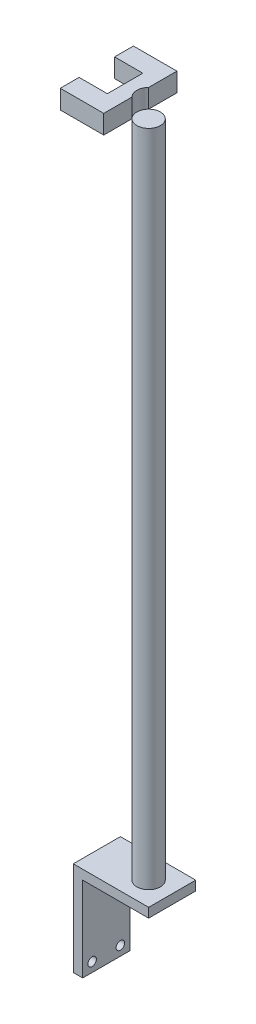
from build123d import *

# Parameters (mm, degrees)
SZKIC1_W                    = 50
SZKIC1_H                    = 100
SZKIC1_R                    = 4.5
DODANIE_WYCI_GNI_CIE1_DEPTH = 10
SZKIC2_W                    = 80
SZKIC2_H                    = 10
DODANIE_WYCI_GNI_CIE2_DEPTH = 50
SZKIC3_R                    = 12.5
DODANIE_WYCI_GNI_CIE3_DEPTH = 700
DODANIE_WYCI_GNI_CIE4_DEPTH = 20


with BuildPart() as part:
    # Szkic1 → Dodanie-wyciągnięcie1 (new body)
    with BuildSketch(Plane(origin=(0, 0, 0), x_dir=(0, 0, -1), z_dir=(1, 0, 0))):
        with Locations((25, 50)):
            Rectangle(SZKIC1_W, SZKIC1_H)
        with Locations((10, 10)):
            Circle(SZKIC1_R, mode=Mode.SUBTRACT)
        with Locations((40, 10)):
            Circle(SZKIC1_R, mode=Mode.SUBTRACT)
    extrude(amount=DODANIE_WYCI_GNI_CIE1_DEPTH)

    # Szkic2 → Dodanie-wyciągnięcie2 (add)
    with BuildSketch(Plane(origin=(0, 0, -50), x_dir=(-1, 0, 0), z_dir=(0, 0, -1))):
        with Locations((-40, 95)):
            Rectangle(SZKIC2_W, SZKIC2_H)
    extrude(amount=-DODANIE_WYCI_GNI_CIE2_DEPTH)

    # Szkic3 → Dodanie-wyciągnięcie3 (add)
    with BuildSketch(Plane(origin=(0, 100, 0), x_dir=(1, 0, 0), z_dir=(0, 1, 0))):
        with Locations((55, 25)):
            Circle(SZKIC3_R)
    extrude(amount=DODANIE_WYCI_GNI_CIE3_DEPTH)


with BuildPart() as body_2:
    # Szkic4 → Dodanie-wyciągnięcie4 (new body)
    with BuildSketch(Plane(origin=(0, 800, 0), x_dir=(1, 0, 0), z_dir=(0, 1, 0))):
        with BuildLine():
            Line((46.161165235, -13.838834765), (46.161165235, 16.161165235))
            ThreePointArc((46.161165235, 16.161165235), (42.5, 25), (46.161165235, 33.838834765))
            Line((46.161165235, 33.838834765), (46.161165235, 63.838834765))
            Line((46.161165235, 63.838834765), (0, 63.838834765))
            Line((0, 63.838834765), (0, 43.838834765))
            Line((0, 43.838834765), (30, 43.838834765))
            Line((30, 43.838834765), (30, 6.161165235))
            Line((30, 6.161165235), (0, 6.161165235))
            Line((0, 6.161165235), (0, -13.838834765))
            Line((0, -13.838834765), (46.161165235, -13.838834765))
        make_face()
    extrude(amount=DODANIE_WYCI_GNI_CIE4_DEPTH)


solid = Compound([part.part, body_2.part])
